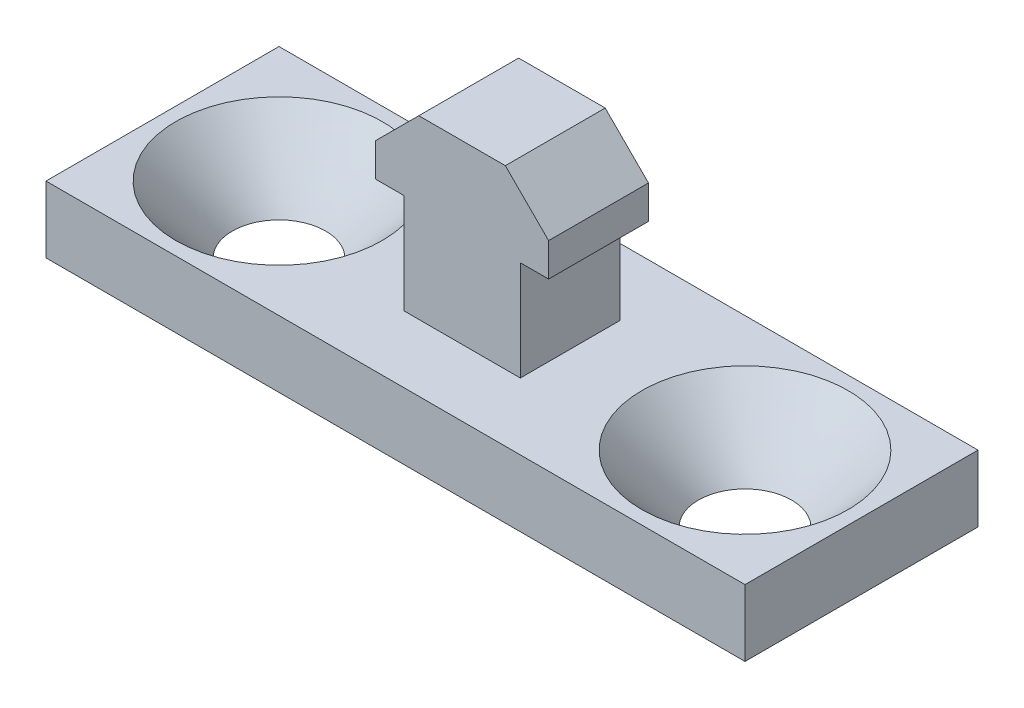
from build123d import *

# Parameters (mm, degrees)
SKETCH1_W                       = 21
SKETCH1_H                       = 7
BOSS_EXTRUDE1_DEPTH             = 2
SKETCH4_W                       = 3.5
SKETCH4_H                       = 3
BOSS_EXTRUDE2_DEPTH             = 3
BOSS_EXTRUDE3_REACH             = 14.145
BOSS_EXTRUDE3_DIRECTION_2_REACH = 14.145


with BuildPart() as part:
    # Sketch1 → Boss-Extrude1 (new body)
    with BuildSketch(Plane(origin=(0, 0, 0), x_dir=(1, 0, 0), z_dir=(0, 1, 0))):
        Rectangle(SKETCH1_W, SKETCH1_H)
    extrude(amount=BOSS_EXTRUDE1_DEPTH)

    # Cut-Loft1: read off the stored shape, not the designer's step
    # Cut-Loft1: loft between two sections, ruled curve by curve
    cut_loft1_from = [
        Edge.make_bspline([(-8.811086142, 2, 2.515942564), (-13.842971271, 2, -1.106229719), (-10.220798987, 2, -6.138114848), (-5.188913858, 2, -2.515942564), (-0.157028729, 2, 1.106229719), (-3.779201013, 2, 6.138114848), (-8.811086142, 2, 2.515942564)], [0, 0, 0, 0, 0.5, 0.5, 0.5, 1, 1, 1, 1], 3, [1, 0.333333333, 0.333333333, 1, 0.333333333, 0.333333333, 1]),
    ]
    cut_loft1_to = [
        Edge.make_bspline([(-7.221614309, 0, 1.3823484), (-9.986311108, 0, 0.939119783), (-9.543082491, 0, -1.825577017), (-6.778385691, 0, -1.3823484), (-4.013688892, 0, -0.939119783), (-4.456917509, 0, 1.825577017), (-7.221614309, 0, 1.3823484)], [0, 0, 0, 0, 0.5, 0.5, 0.5, 1, 1, 1, 1], 3, [1, 0.333333333, 0.333333333, 1, 0.333333333, 0.333333333, 1]),
    ]
    cut_loft1 = Solid(Shell([*[Face.make_surface_from_curves(cut_loft1_from[k], cut_loft1_to[k]) for k in range(1)], Face(Wire(cut_loft1_from)), Face(Wire(cut_loft1_to))]))
    add(cut_loft1, mode=Mode.SUBTRACT)

    # Mirror1: Cut-Loft1 across plane
    add(cut_loft1.mirror(Plane(origin=(0, 0, 0), x_dir=(0, 0, 1), z_dir=(1, 0, 0))), mode=Mode.SUBTRACT)

    # Sketch4 → Boss-Extrude2 (add)
    with BuildSketch(Plane(origin=(0, 2, 0), x_dir=(1, 0, 0), z_dir=(0, 1, 0))):
        Rectangle(SKETCH4_W, SKETCH4_H)
    extrude(amount=BOSS_EXTRUDE2_DEPTH)

    # Boss-Extrude3: up to this face of the body (flat: up to its plane)
    boss_extrude3_end = Plane(part.part.faces().sort_by_distance((0, 3.5, 1.5))[0])
    # Sketch5 → Boss-Extrude3 (add, up to the picked face)
    with BuildSketch(Plane.XY, mode=Mode.PRIVATE) as boss_extrude3_sk1:
        Polygon((-2.6, 5), (-2.6, 6), (-1.3, 7.3), (1.3, 7.3), (2.6, 6), (2.6, 5), align=None)
    boss_extrude3_tool1 = split(extrude(boss_extrude3_sk1.sketch, amount=BOSS_EXTRUDE3_REACH, mode=Mode.PRIVATE), bisect_by=boss_extrude3_end, keep=Keep.BOTH, mode=Mode.PRIVATE)
    add(boss_extrude3_tool1.solids().sort_by(Axis((0, 6.032068, 0), (0, 0, 1)))[0])

    # Boss-Extrude3 direction 2: up to this face of the body (flat: up to its plane)
    boss_extrude3_direction_2_end = Plane(part.part.faces().sort_by_distance((0, 3.5, -1.5))[0])
    # Sketch5 → Boss-Extrude3 direction 2 (add, up to the picked face)
    with BuildSketch(Plane.XY, mode=Mode.PRIVATE) as boss_extrude3_direction_2_sk1:
        Polygon((-2.6, 5), (-2.6, 6), (-1.3, 7.3), (1.3, 7.3), (2.6, 6), (2.6, 5), align=None)
    boss_extrude3_direction_2_tool1 = split(extrude(boss_extrude3_direction_2_sk1.sketch, amount=-BOSS_EXTRUDE3_DIRECTION_2_REACH, mode=Mode.PRIVATE), bisect_by=boss_extrude3_direction_2_end, keep=Keep.BOTH, mode=Mode.PRIVATE)
    add(boss_extrude3_direction_2_tool1.solids().sort_by(Axis((0, 6.032068, 0), (0, 0, -1)))[0])


solid = part.part
